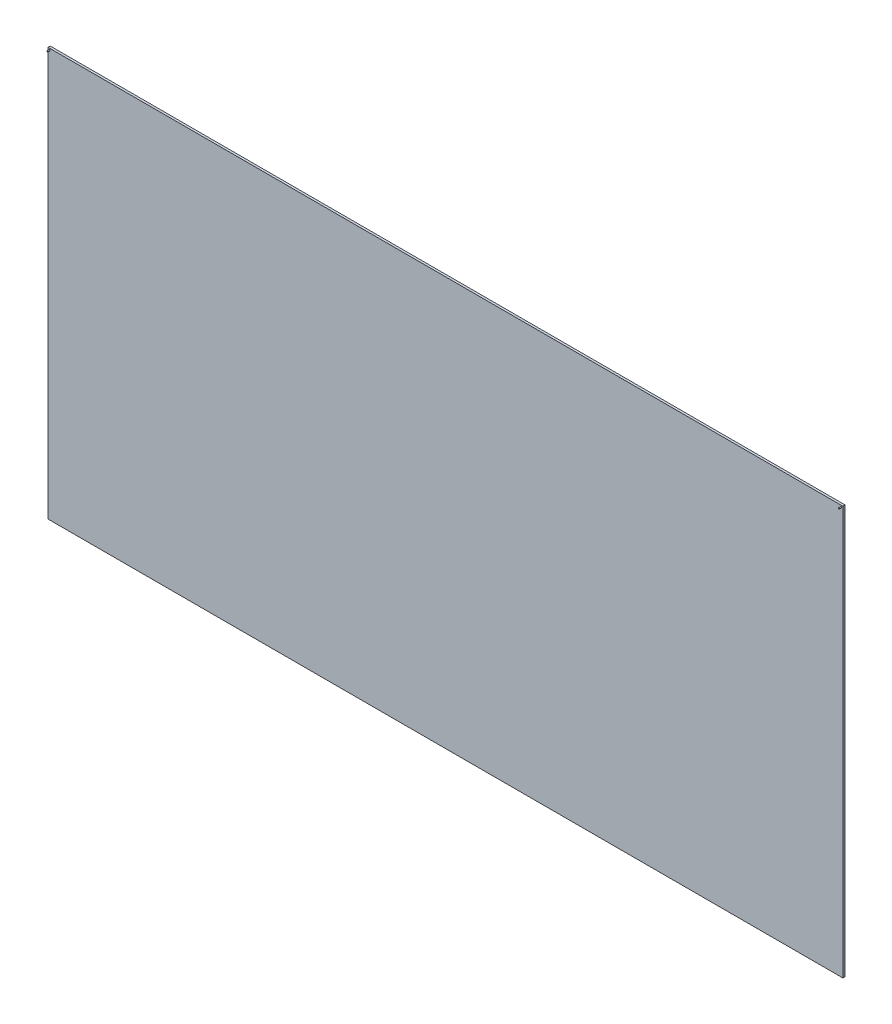
from build123d import *

# Parameters (mm, degrees)
SKETCH1_W           = 3565.53
SKETCH1_H           = 1832.766953
BOSS_EXTRUDE1_DEPTH = 10
SKETCH2_R           = 2.5
BOSS_EXTRUDE2_DEPTH = 10


with BuildPart() as part:
    # Sketch1 → Boss-Extrude1 (new body)
    with BuildSketch(Plane.XY):
        with Locations((1767.765, 866.3834765)):
            Rectangle(SKETCH1_W, SKETCH1_H)
    extrude(amount=BOSS_EXTRUDE1_DEPTH)

    # Sketch2 → Boss-Extrude2 (add)
    with BuildSketch(Plane.XY.offset(10)):
        with Locations((-7.5, 1775.266953)):
            Circle(SKETCH2_R)
        with Locations((3543.03, 1775.266953)):
            Circle(SKETCH2_R)
    extrude(amount=BOSS_EXTRUDE2_DEPTH)


solid = part.part
